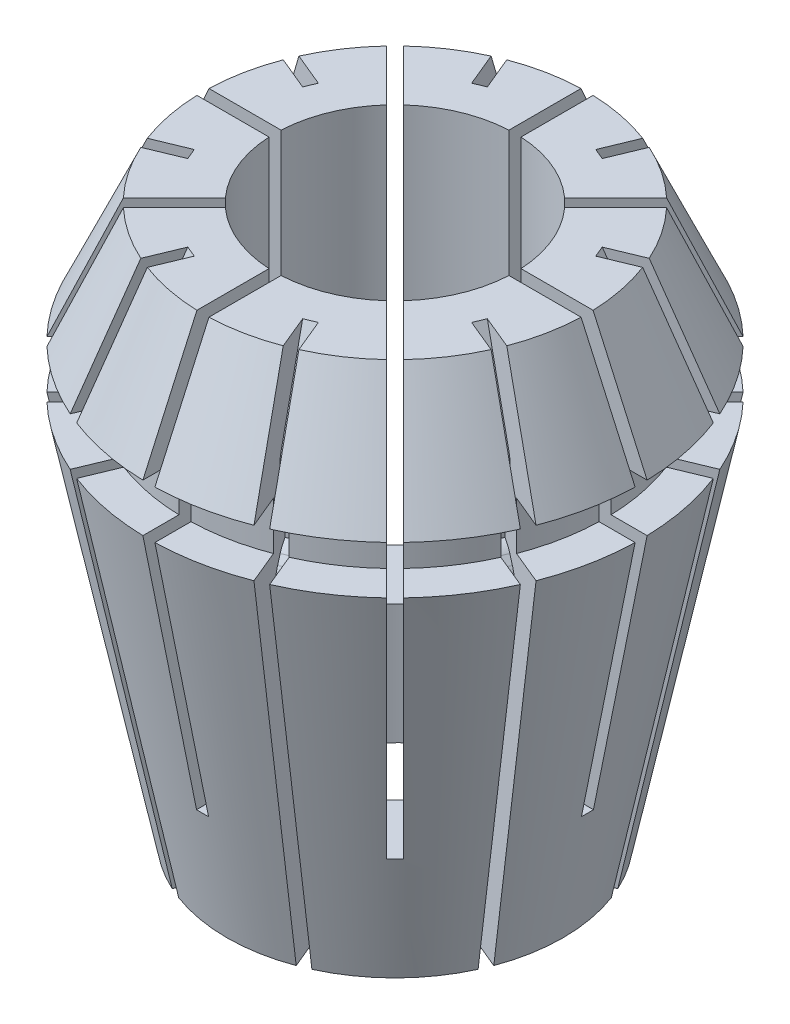
from build123d import *

# Parameters (mm, degrees)
SKETCH_2_W                             = 1
SKETCH_2_H                             = 36
CUT_EXTRUDE_1_DEPTH                    = 44.179856415
PATTERN_CIRCULAR_1_COUNT               = 4
PATTERN_CIRCULAR_1_ANGLE               = 135
SWEEP_START                            = -0.5
SWEEP_1_DEPTH                          = 1
CUT_EXTRUDE_3_DEPTH                    = 4
CHAMFER_1_SIZE                         = 1.512531876
CHAMFER_1_SIZE_2                       = 2
CHAMFER_1_SIZE_3                       = 1.696284869
FILLET_1_R                             = 2
PATTERN_CIRCULAR_6_COUNT               = 8
CHAMFER_1_OF_PATTERN_CIRCULAR_6_SIZE   = 1.512531876
CHAMFER_1_OF_PATTERN_CIRCULAR_6_SIZE_2 = 2
CHAMFER_1_OF_PATTERN_CIRCULAR_6_SIZE_3 = 1.696284869
FILLET_1_OF_PATTERN_CIRCULAR_6_R       = 2


# Read off the part's stored shape, not the designer's step: 切除-扫描1
with BuildPart() as part:
    # 草图1 → 旋转1 (revolve)
    with BuildSketch(Plane.XY, mode=Mode.PRIVATE) as revolve_1_sk:
        Polygon((10, 14), (16, 14), (20.5, 4), (17.5, 4), (17.5, 0), (20.5, 0), (14, -32), (10, -32), align=None)
    revolve(revolve_1_sk.sketch.rotate(Axis((0, 47.222543529, 0), (0, -1, 0)), 90), axis=Axis((0, 47.222543529, 0), (0, -1, 0)))

    # 草图2 → 切除-拉伸1 (cut, symmetric)
    with BuildSketch(Plane.XY):
        with Locations((0, -4)):
            Rectangle(SKETCH_2_W, SKETCH_2_H)
    cut_extrude_1 = extrude(amount=CUT_EXTRUDE_1_DEPTH, both=True, mode=Mode.SUBTRACT)

    # 阵列(圆周)1: 切除-拉伸1 ×4 about axis
    pattern_circular_1_axis = Axis((0, 0, 0), (0, 1, 0))
    for i in range(1, PATTERN_CIRCULAR_1_COUNT):
        add(cut_extrude_1.rotate(pattern_circular_1_axis, i * PATTERN_CIRCULAR_1_ANGLE / (PATTERN_CIRCULAR_1_COUNT - 1)), mode=Mode.SUBTRACT)

    # 切除-扫描1 outline → 切除-扫描1 (cut)
    with BuildSketch(Plane(origin=(0, 0, 0), x_dir=(0.9238795325112866, 0, -0.38268343236508984), z_dir=(0.3826834323650899, 0, 0.9238795325112867)).offset(SWEEP_START)):
        Polygon((17.708367434, 0), (10.802117434, -34), (22, -34), (22, 0), align=None)
        Polygon((22, 14), (13, 14), (17.5, 4), (22, 4), align=None)
    sweep_1 = extrude(amount=SWEEP_1_DEPTH, mode=Mode.SUBTRACT)

    # 草图5 → 切除-拉伸3 (cut)
    with BuildSketch(Plane(origin=(0, 0, 0), x_dir=(1, 0, 0), z_dir=(0, 1, 0))):
        Polygon((16.551739943, 6.314759065), (16.16905651, 7.238638598), (14.321297445, 6.473271733), (14.703980878, 5.5493922), align=None)
    cut_extrude_3 = extrude(amount=CUT_EXTRUDE_3_DEPTH, mode=Mode.SUBTRACT)

    # 倒角1
    # the kernel refuses this chamfer: 2, 1.696284869, 1.512531876 mm, written as the material it takes off along each edge
    with BuildSketch(Plane(origin=(15.976550103, 4, -7.158899833), x_dir=(-0.9227929361159211, -0.04848570572877577, 0.38223334940130543), z_dir=(0.3826834323650914, 0, 0.9238795325112861))) as chamfer_1_piece_1:
        Polygon((CHAMFER_1_SIZE * 0.998823876421, -CHAMFER_1_SIZE * 0.0484857057232), (CHAMFER_1_SIZE_2 * 0.365666880056, -CHAMFER_1_SIZE_2 * 0.930745793883), (0, 0), align=None)
    extrude(amount=1, mode=Mode.SUBTRACT)
    with BuildSketch(Plane(origin=(16.16905651, 0, -7.238638597), x_dir=(-0.15894335956361294, -0.9850901300657692, 0.06583649518039188), z_dir=(0.3826834323650899, 0, 0.9238795325112867))) as chamfer_1_piece_2:
        Polygon((CHAMFER_1_SIZE_2 * 0.999621916911, -CHAMFER_1_SIZE_2 * 0.0274958766106), (CHAMFER_1_SIZE_3 * 0.172039052713, -CHAMFER_1_SIZE_3 * 0.985090130255), (0, 0), align=None)
    extrude(amount=1, mode=Mode.SUBTRACT)

    # 圆角1
    # the kernel refuses this fillet: 2 mm, written as the material it adds along each edge
    with BuildSketch(Plane(origin=(13.34634354, 4, -8.827018674), x_dir=(0, -1, 0), z_dir=(0.38268343236509084, 0, 0.9238795325112864))) as fillet_1_piece_1:
        with BuildLine():
            CenterArc((1.019070932, 2), FILLET_1_R, 239.367107669, 30.632892331)
            Line((0, 0.27910069), (-0.020381419, 0.244682704))
            ThreePointArc((-0.020381419, 0.244682704), (-0.04, 0.139550345), (-0.04, 0))
            Line((-0.04, 0), (0, -0.04))
            Line((0, -0.04), (1.019070932, -0.04))
            Line((1.019070932, -0.04), (1.019070932, 0))
        make_face()
    extrude(amount=6.095354662)
    # the kernel refuses this fillet: 2 mm, written as the material it takes off along each edge
    with BuildSketch(Plane(origin=(15.801241731, -1.959974639, -7.086284727), x_dir=(-0.18390738979402452, -0.9799873195822397, 0.07617693507332605), z_dir=(0.38268343236511454, 0, 0.9238795325112765))) as fillet_1_2_piece_1:
        with BuildLine():
            CenterArc((FILLET_1_R * 0.414213562372, -FILLET_1_R), FILLET_1_R, 90, 45)
            Line((-FILLET_1_R * 0.292893218814, -FILLET_1_R * 0.292893218813), (-FILLET_1_R * 0.307035354438, -FILLET_1_R * 0.278751083189))
            Line((-FILLET_1_R * 0.307035354438, -FILLET_1_R * 0.278751083189), (-FILLET_1_R * 0.00828427124745, FILLET_1_R * 0.02))
            Line((-FILLET_1_R * 0.00828427124745, FILLET_1_R * 0.02), (FILLET_1_R * 0.414213562373, FILLET_1_R * 0.02))
            Line((FILLET_1_R * 0.414213562373, FILLET_1_R * 0.02), (FILLET_1_R * 0.414213562373, 0))
        make_face()
    extrude(amount=1, mode=Mode.SUBTRACT)
    with BuildSketch(Plane(origin=(14.601893638, 0, -6.589498481), x_dir=(0.5101654064730808, -0.8337123014811908, -0.21131743041474887), z_dir=(0.38268343236511454, 0, 0.9238795325112765))) as fillet_1_2_piece_2:
        with BuildLine():
            CenterArc((0.806315655, -2), FILLET_1_R, 90, 29.144471406)
            Line((-0.167711209, -0.253211041), (-0.187191746, -0.218275261))
            ThreePointArc((-0.187191746, -0.218275261), (-0.117204096, -0.104517558), (-0.033348492, 0.022087962))
            Line((-0.033348492, 0.022087962), (0, 0.04))
            Line((0, 0.04), (0.806315655, 0.04))
            Line((0.806315655, 0.04), (0.806315655, 0))
        make_face()
    extrude(amount=1, mode=Mode.SUBTRACT)
    with BuildSketch(Plane(origin=(15.21829505, 5.82384301, -6.844820306), x_dir=(-0.3791275262488996, 0.9119215051754819, 0.1570397632412677), z_dir=(0.38268343236511454, 0, 0.9238795325112765))) as fillet_1_2_piece_3:
        with BuildLine():
            CenterArc((FILLET_1_R * 0.414213562372, FILLET_1_R), FILLET_1_R, 225, 45)
            Line((-FILLET_1_R * 0.292893218814, FILLET_1_R * 0.292893218812), (-FILLET_1_R * 0.307035354438, FILLET_1_R * 0.278751083189))
            Line((-FILLET_1_R * 0.307035354438, FILLET_1_R * 0.278751083189), (-FILLET_1_R * 0.00828427124743, -FILLET_1_R * 0.02))
            Line((-FILLET_1_R * 0.00828427124743, -FILLET_1_R * 0.02), (FILLET_1_R * 0.414213562373, -FILLET_1_R * 0.02))
            Line((FILLET_1_R * 0.414213562373, -FILLET_1_R * 0.02), (FILLET_1_R * 0.414213562373, 0))
        make_face()
    extrude(amount=1, mode=Mode.SUBTRACT)

    # 阵列(圆周)6: 切除-扫描1, 切除-拉伸3 ×8 about axis
    pattern_circular_6_axis = Axis((0, 0, 0), (0, 1, 0))
    add([sweep_1.rotate(pattern_circular_6_axis, i * 360 / PATTERN_CIRCULAR_6_COUNT) for i in range(1, PATTERN_CIRCULAR_6_COUNT)], mode=Mode.SUBTRACT)
    add([cut_extrude_3.rotate(pattern_circular_6_axis, i * 360 / PATTERN_CIRCULAR_6_COUNT) for i in range(1, PATTERN_CIRCULAR_6_COUNT)], mode=Mode.SUBTRACT)

    # 倒角1 of 阵列(圆周)6
    # the kernel refuses this chamfer: 2, 1.696284869, 1.512531876 mm, written as the material it takes off along each edge
    with BuildSketch(Plane(origin=(6.2350203, 4, -16.359233535), x_dir=(-0.3822333494013036, -0.04848570572877577, 0.9227929361159217), z_dir=(0.923879532511287, 0, 0.3826834323650896)), Plane(origin=(-7.158899833, 4, -15.976550103), x_dir=(0.3822333494013054, -0.048485705728775766, 0.9227929361159208), z_dir=(0.9238795325112861, 0, -0.3826834323650914)), Plane(origin=(-16.359233535, 4, -6.2350203), x_dir=(0.9227929361159231, -0.04848570572877579, 0.3822333494013006), z_dir=(0.38268343236508656, 0, -0.9238795325112882)), Plane(origin=(-15.976550103, 4, 7.158899833), x_dir=(0.9227929361159211, -0.04848570572877577, -0.38223334940130543), z_dir=(-0.3826834323650914, 0, -0.9238795325112861)), Plane(origin=(-6.2350203, 4, 16.359233535), x_dir=(0.3822333494013006, -0.048485705728775766, -0.922792936115923), z_dir=(-0.9238795325112882, 0, -0.38268343236508656)), Plane(origin=(7.158899833, 4, 15.976550103), x_dir=(-0.38223334940130393, -0.04848570572877578, -0.9227929361159216), z_dir=(-0.9238795325112867, 0, 0.3826834323650899)), Plane(origin=(16.359233535, 4, 6.2350203), x_dir=(-0.9227929361159223, -0.04848570572877577, -0.38223334940130205), z_dir=(-0.38268343236508806, 0, 0.9238795325112875))) as chamfer_1_of_pattern_circular_6_piece_1:
        Polygon((CHAMFER_1_OF_PATTERN_CIRCULAR_6_SIZE * 0.998823876421, -CHAMFER_1_OF_PATTERN_CIRCULAR_6_SIZE * 0.0484857057232), (CHAMFER_1_OF_PATTERN_CIRCULAR_6_SIZE_2 * 0.365666880056, -CHAMFER_1_OF_PATTERN_CIRCULAR_6_SIZE_2 * 0.930745793883), (0, 0), align=None)
    extrude(amount=1, mode=Mode.SUBTRACT)
    with BuildSketch(Plane(origin=(6.314759065, 0, -16.551739943), x_dir=(-0.06583649518039167, -0.9850901300657694, 0.15894335956361247), z_dir=(0.9238795325112868, 0, 0.3826834323650898)), Plane(origin=(-7.238638597, 0, -16.16905651), x_dir=(0.06583649518039188, -0.9850901300657692, 0.158943359563613), z_dir=(0.9238795325112867, 0, -0.3826834323650898)), Plane(origin=(-16.551739943, 0, -6.314759065), x_dir=(0.15894335956361233, -0.9850901300657694, 0.06583649518039159), z_dir=(0.3826834323650898, 0, -0.9238795325112868)), Plane(origin=(-16.16905651, 0, 7.238638597), x_dir=(0.158943359563613, -0.9850901300657692, -0.06583649518039188), z_dir=(-0.3826834323650898, 0, -0.9238795325112867)), Plane(origin=(-6.314759065, 0, 16.551739943), x_dir=(0.0658364951803917, -0.9850901300657694, -0.15894335956361252), z_dir=(-0.9238795325112867, 0, -0.38268343236508984)), Plane(origin=(7.238638597, 0, 16.16905651), x_dir=(-0.06583649518039188, -0.9850901300657692, -0.15894335956361305), z_dir=(-0.9238795325112868, 0, 0.38268343236508967)), Plane(origin=(16.551739943, 0, 6.314759065), x_dir=(-0.1589433595636125, -0.9850901300657694, -0.0658364951803917), z_dir=(-0.3826834323650899, 0, 0.9238795325112867))) as chamfer_1_of_pattern_circular_6_piece_2:
        Polygon((CHAMFER_1_OF_PATTERN_CIRCULAR_6_SIZE_2 * 0.999621916911, -CHAMFER_1_OF_PATTERN_CIRCULAR_6_SIZE_2 * 0.0274958766106), (CHAMFER_1_OF_PATTERN_CIRCULAR_6_SIZE_3 * 0.172039052713, -CHAMFER_1_OF_PATTERN_CIRCULAR_6_SIZE_3 * 0.985090130255), (0, 0), align=None)
    extrude(amount=1, mode=Mode.SUBTRACT)

    # 圆角1 of 阵列(圆周)6
    # the kernel refuses this fillet: 2 mm, written as the material it adds along each edge
    with BuildSketch(Plane(origin=(3.195645259, 4, -15.678934783), x_dir=(0, -1, 0), z_dir=(0.9238795325112872, 0, 0.38268343236508884)), Plane(origin=(-8.827018674, 4, -13.34634354), x_dir=(0, -1, 0), z_dir=(0.9238795325112864, 0, -0.3826834323650907)), Plane(origin=(-15.678934783, 4, -3.195645259), x_dir=(0, -1, 0), z_dir=(0.38268343236508884, 0, -0.9238795325112872)), Plane(origin=(-13.34634354, 4, 8.827018674), x_dir=(0, -1, 0), z_dir=(-0.3826834323650907, 0, -0.9238795325112864)), Plane(origin=(-3.195645259, 4, 15.678934783), x_dir=(0, -1, 0), z_dir=(-0.9238795325112872, 0, -0.3826834323650889)), Plane(origin=(8.827018674, 4, 13.34634354), x_dir=(0, -1, 0), z_dir=(-0.9238795325112865, 0, 0.3826834323650906)), Plane(origin=(15.678934783, 4, 3.195645259), x_dir=(0, -1, 0), z_dir=(-0.382683432365089, 0, 0.9238795325112871))) as fillet_1_of_pattern_circular_6_piece_1:
        with BuildLine():
            CenterArc((1.019070932, 2), FILLET_1_OF_PATTERN_CIRCULAR_6_R, 239.367107669, 30.632892331)
            Line((0, 0.27910069), (-0.020381419, 0.244682704))
            ThreePointArc((-0.020381419, 0.244682704), (-0.04, 0.139550345), (-0.04, 0))
            Line((-0.04, 0), (0, -0.04))
            Line((0, -0.04), (1.019070932, -0.04))
            Line((1.019070932, -0.04), (1.019070932, 0))
        make_face()
    extrude(amount=6.095354662)
    # the kernel refuses this fillet: 2 mm, written as the material it takes off along each edge
    with BuildSketch(Plane(origin=(6.162405195, -1.959974639, -16.183925163), x_dir=(-0.07617693507374695, -0.9799873195820163, 0.18390738979504065), z_dir=(0.9238795325112765, 0, 0.38268343236511454)), Plane(origin=(5.920940774, 5.82384301, -15.600978483), x_dir=(-0.1357202996157905, -0.9349975263180591, 0.3276577880217565), z_dir=(0.9238795325112765, 0, 0.38268343236511454)), Plane(origin=(-7.086284727, -1.959974639, -15.801241731), x_dir=(0.07617693507332526, -0.9799873195822403, 0.18390738979402257), z_dir=(0.9238795325112765, 0, -0.38268343236511454)), Plane(origin=(-6.844820306, 5.82384301, -15.21829505), x_dir=(0.13572029961579035, -0.9349975263180592, 0.3276577880217562), z_dir=(0.9238795325112765, 0, -0.38268343236511454)), Plane(origin=(-16.183925163, -1.959974639, -6.162405195), x_dir=(0.1839073897950411, -0.9799873195820161, 0.07617693507374713), z_dir=(0.38268343236511454, 0, -0.9238795325112765)), Plane(origin=(-15.600978483, 5.82384301, -5.920940774), x_dir=(0.3276577880217565, -0.9349975263180591, 0.1357202996157905), z_dir=(0.38268343236511454, 0, -0.9238795325112765)), Plane(origin=(-15.801241731, -1.959974639, 7.086284727), x_dir=(0.18390738979402269, -0.9799873195822403, -0.07617693507332529), z_dir=(-0.38268343236511454, 0, -0.9238795325112765)), Plane(origin=(-15.21829505, 5.82384301, 6.844820306), x_dir=(0.3276577880217559, -0.9349975263180594, -0.1357202996157902), z_dir=(-0.38268343236511454, 0, -0.9238795325112765)), Plane(origin=(-6.162405195, -1.959974639, 16.183925163), x_dir=(0.07617693507374874, -0.9799873195820153, -0.183907389795045), z_dir=(-0.9238795325112765, 0, -0.38268343236511454)), Plane(origin=(-5.920940774, 5.82384301, 15.600978483), x_dir=(0.13572029961579063, -0.934997526318059, -0.3276577880217569), z_dir=(-0.9238795325112765, 0, -0.38268343236511454)), Plane(origin=(7.086284727, -1.959974639, 15.801241731), x_dir=(-0.07617693507332716, -0.9799873195822392, -0.1839073897940272), z_dir=(-0.9238795325112765, 0, 0.38268343236511454)), Plane(origin=(6.844820306, 5.82384301, 15.21829505), x_dir=(-0.13572029961579035, -0.9349975263180592, -0.3276577880217562), z_dir=(-0.9238795325112765, 0, 0.38268343236511454)), Plane(origin=(16.183925163, -1.959974639, 6.162405195), x_dir=(-0.183907389795045, -0.9799873195820153, -0.07617693507374874), z_dir=(-0.38268343236511454, 0, 0.9238795325112765)), Plane(origin=(15.600978483, 5.82384301, 5.920940774), x_dir=(-0.3276577880217569, -0.934997526318059, -0.1357202996157906), z_dir=(-0.38268343236511454, 0, 0.9238795325112765))) as fillet_1_of_pattern_circular_6_2_piece_1:
        with BuildLine():
            CenterArc((FILLET_1_OF_PATTERN_CIRCULAR_6_R * 0.414213562373, -FILLET_1_OF_PATTERN_CIRCULAR_6_R), FILLET_1_OF_PATTERN_CIRCULAR_6_R, 90, 45)
            Line((-FILLET_1_OF_PATTERN_CIRCULAR_6_R * 0.292893218813, -FILLET_1_OF_PATTERN_CIRCULAR_6_R * 0.292893218814), (-FILLET_1_OF_PATTERN_CIRCULAR_6_R * 0.307035354437, -FILLET_1_OF_PATTERN_CIRCULAR_6_R * 0.27875108319))
            Line((-FILLET_1_OF_PATTERN_CIRCULAR_6_R * 0.307035354437, -FILLET_1_OF_PATTERN_CIRCULAR_6_R * 0.27875108319), (-FILLET_1_OF_PATTERN_CIRCULAR_6_R * 0.00828427124747, FILLET_1_OF_PATTERN_CIRCULAR_6_R * 0.02))
            Line((-FILLET_1_OF_PATTERN_CIRCULAR_6_R * 0.00828427124747, FILLET_1_OF_PATTERN_CIRCULAR_6_R * 0.02), (FILLET_1_OF_PATTERN_CIRCULAR_6_R * 0.414213562373, FILLET_1_OF_PATTERN_CIRCULAR_6_R * 0.02))
            Line((FILLET_1_OF_PATTERN_CIRCULAR_6_R * 0.414213562373, FILLET_1_OF_PATTERN_CIRCULAR_6_R * 0.02), (FILLET_1_OF_PATTERN_CIRCULAR_6_R * 0.414213562373, 0))
        make_face()
    extrude(amount=1, mode=Mode.SUBTRACT)
    with BuildSketch(Plane(origin=(5.665618949, 0, -14.984577071), x_dir=(0.21131743041474968, -0.8337123014811894, -0.5101654064730827), z_dir=(0.9238795325112765, 0, 0.38268343236511454)), Plane(origin=(-6.589498481, 0, -14.601893638), x_dir=(-0.211317430414749, -0.8337123014811906, -0.5101654064730812), z_dir=(0.9238795325112765, 0, -0.38268343236511454)), Plane(origin=(-14.984577071, 0, -5.665618949), x_dir=(-0.5101654064730827, -0.8337123014811894, -0.21131743041474968), z_dir=(0.38268343236511454, 0, -0.9238795325112765)), Plane(origin=(-14.601893638, 0, 6.589498481), x_dir=(-0.5101654064730818, -0.8337123014811901, 0.2113174304147493), z_dir=(-0.38268343236511454, 0, -0.9238795325112765)), Plane(origin=(-5.665618949, 0, 14.984577071), x_dir=(-0.21131743041474946, -0.8337123014811898, 0.5101654064730823), z_dir=(-0.9238795325112765, 0, -0.38268343236511454)), Plane(origin=(6.589498481, 0, 14.601893638), x_dir=(0.21131743041474893, -0.8337123014811907, 0.510165406473081), z_dir=(-0.9238795325112765, 0, 0.38268343236511454)), Plane(origin=(14.984577071, 0, 5.665618949), x_dir=(0.5101654064730828, -0.8337123014811894, 0.21131743041474974), z_dir=(-0.38268343236511454, 0, 0.9238795325112765))) as fillet_1_of_pattern_circular_6_2_piece_2:
        with BuildLine():
            CenterArc((0.806315655, -2), FILLET_1_OF_PATTERN_CIRCULAR_6_R, 90, 29.144471407)
            Line((-0.167711209, -0.253211041), (-0.187191746, -0.218275261))
            ThreePointArc((-0.187191746, -0.218275261), (-0.117204096, -0.104517558), (-0.033348492, 0.022087962))
            Line((-0.033348492, 0.022087962), (0, 0.04))
            Line((0, 0.04), (0.806315655, 0.04))
            Line((0.806315655, 0.04), (0.806315655, 0))
        make_face()
    extrude(amount=1, mode=Mode.SUBTRACT)


solid = part.part
